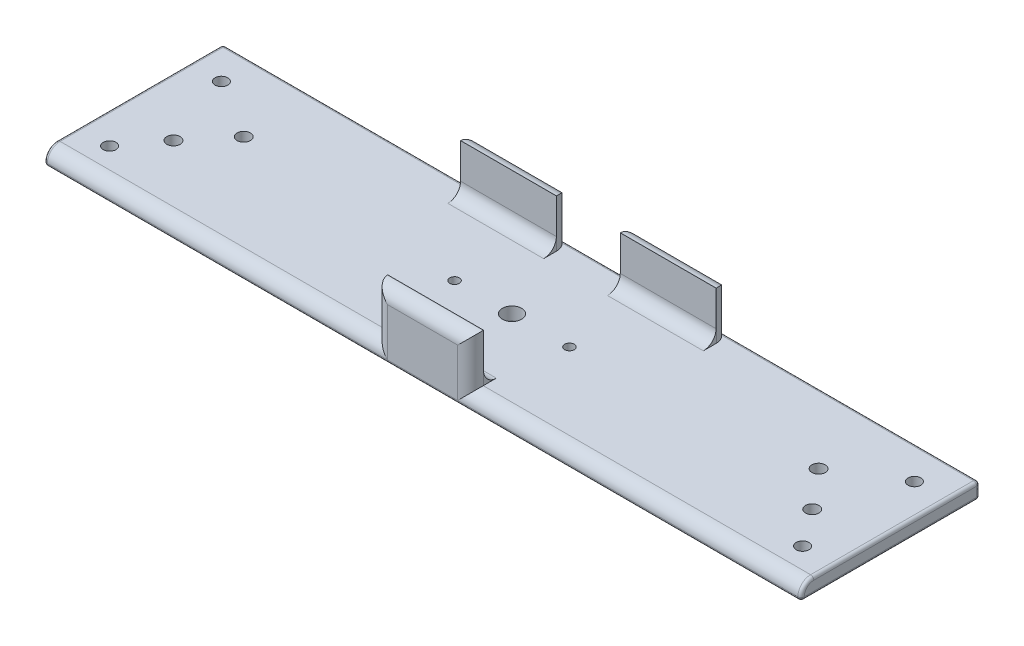
from build123d import *

# Parameters (mm, degrees)
SKETCH1_W           = 237
SKETCH1_H           = 56
BOSS_EXTRUDE1_DEPTH = 5
SKETCH2_R           = 1.5
SKETCH2_R_2         = 3
CUT_EXTRUDE1_DEPTH  = 5
SKETCH5_W           = 30
SKETCH5_H           = 4.1
BOSS_EXTRUDE2_DEPTH = 15
FILLET1_R           = 4
FILLET3_R           = 4
FILLET8_R           = 1
SKETCH14_R          = 2
CUT_EXTRUDE6_DEPTH  = 60
SKETCH15_R          = 2.1
CUT_EXTRUDE7_DEPTH  = 60


with BuildPart() as part:
    # Sketch1 → Boss-Extrude1 (new body)
    with BuildSketch(Plane(origin=(0, 0, 0), x_dir=(1, 0, 0), z_dir=(0, 1, 0))):
        Rectangle(SKETCH1_W, SKETCH1_H)
    extrude(amount=BOSS_EXTRUDE1_DEPTH)

    # Sketch2 → Cut-Extrude1 (cut)
    with BuildSketch(Plane.XZ):
        with Locations(Location((-18, 0, 0), (0, 0, 270))):
            Circle(SKETCH2_R)
        with Locations(Location((18, 0, 0), (0, 0, 90))):
            Circle(SKETCH2_R)
        with Locations(Location((0, 0, 0), (0, 0, 270))):
            Circle(SKETCH2_R_2)
    extrude(amount=-CUT_EXTRUDE1_DEPTH, mode=Mode.SUBTRACT)

    # Sketch5 → Boss-Extrude2 (add)
    with BuildSketch(Plane(origin=(0, 5, 0), x_dir=(1, 0, 0), z_dir=(0, 1, 0))):
        with Locations((0, -25.95)):
            Rectangle(SKETCH5_W, SKETCH5_H)
        with Locations((25, 25.95)):
            Rectangle(SKETCH5_W, SKETCH5_H)
        with Locations((-25, 25.95)):
            Rectangle(SKETCH5_W, SKETCH5_H)
    extrude(amount=BOSS_EXTRUDE2_DEPTH)

    # Fillet1
    fillet1_edges = [part.edges().sort_by_distance(p)[0] for p in [
        (-66.75, 5, 28),
        (66.75, 5, 28),
        (15, 12.5, 28),
        (-15, 12.5, 28),
        (0, 20, 28),
        (40, 12.5, -28),
        (10, 12.5, -28),
        (25, 20, -28),
        (-10, 12.5, -28),
        (-40, 12.5, -28),
        (-25, 20, -28),
    ]]
    fillet(fillet1_edges, radius=FILLET1_R)

    # Fillet3
    fillet3_edges = [part.edges().sort_by_distance(p)[0] for p in [
        (0, 5, 23.9),
        (25, 5, -23.9),
        (-25, 5, -23.9),
    ]]
    fillet(fillet3_edges, radius=FILLET3_R)

    # Fillet8
    fillet8_edges = [part.edges().sort_by_distance(p)[0] for p in [
        (0, 0, 28),
        (-18, 0, 1.5),
        (18, 0, -1.5),
        (0, 0, 3),
        (118.5, 0, 0),
        (118.5, 3.828427125, 26.828427125),
        (118.5, 5, -2),
        (0, 5, -28),
        (-77.25, 5, -28),
        (0, 0, -28),
        (118.5, 2.5, -28),
        (77.25, 5, -28),
        (-118.5, 0, 0),
        (-118.5, 2.5, -28),
        (-118.5, 5, -2),
        (-118.5, 3.828427125, 26.828427125),
    ]]
    fillet(fillet8_edges, radius=FILLET8_R - 0.0001)  # a hair under: the kernel refuses the full size

    # Sketch14 → Cut-Extrude6 (cut)
    with BuildSketch(Plane.XZ):
        with Locations(Location((-108.5, 17.5, 0), (0, 0, 270))):
            Circle(SKETCH14_R)
        with Locations(Location((-108.5, -17.5, 0), (0, 0, 270))):
            Circle(SKETCH14_R)
        with Locations(Location((108.5, -17.5, 0), (0, 0, 270))):
            Circle(SKETCH14_R)
        with Locations(Location((108.5, 17.5, 0), (0, 0, 270))):
            Circle(SKETCH14_R)
    extrude(amount=-CUT_EXTRUDE6_DEPTH, mode=Mode.SUBTRACT)

    # Sketch15 → Cut-Extrude7 (cut)
    with BuildSketch(Plane(origin=(0, 5, 0), x_dir=(1, 0, 0), z_dir=(0, 1, 0))):
        with Locations(Location((-90, 6, 0), (0, 0, 270))):
            Circle(SKETCH15_R)
        with Locations(Location((-100, -6, 0), (0, 0, 270))):
            Circle(SKETCH15_R)
        with Locations(Location((100, -6, 0), (0, 0, 90))):
            Circle(SKETCH15_R)
        with Locations(Location((90, 6, 0), (0, 0, 90))):
            Circle(SKETCH15_R)
    extrude(amount=-CUT_EXTRUDE7_DEPTH, mode=Mode.SUBTRACT)


solid = part.part
